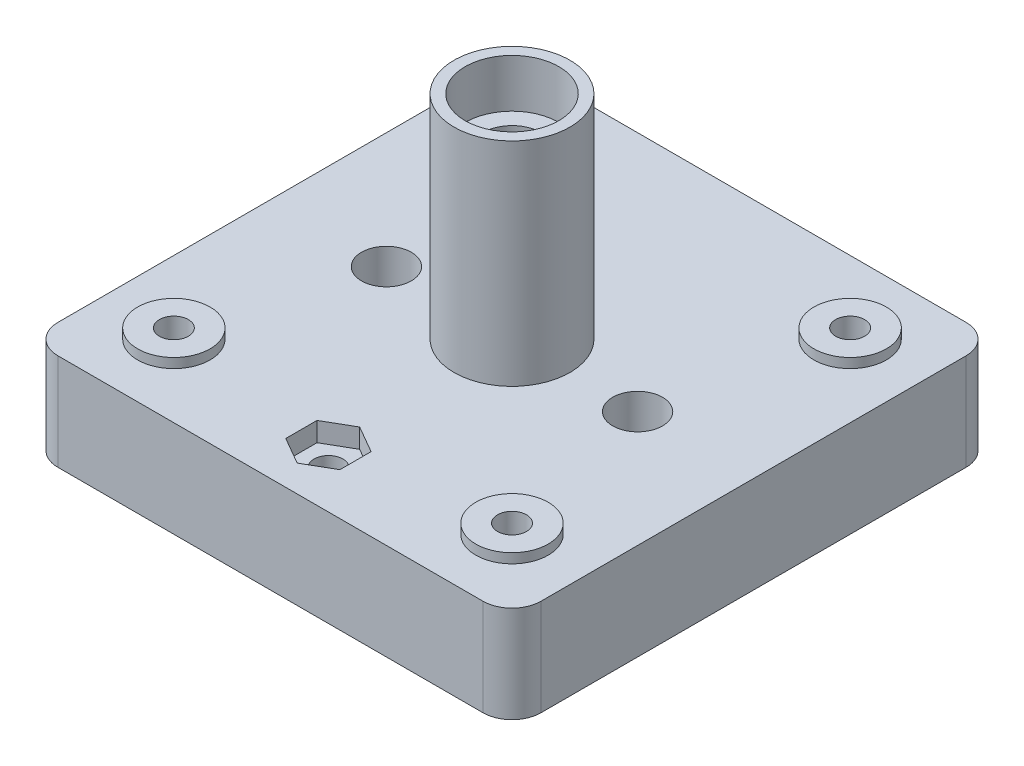
from build123d import *
from OCP.BRepFilletAPI import BRepFilletAPI_MakeChamfer

# Parameters (mm, degrees)
SKETCH1_W               = 50
SKETCH1_H               = 50
BODY_DEPTH              = 10
SKETCH2_R               = 11.5
CUT_VIEW_DEPTH          = 6
FILLETBODY_R            = 3
SKETCH3_R               = 3.75
BOLT_EXTRUDE_DEPTH      = 1
BOLT_DEPTH              = 10
BOLT_DEPTH_BACK         = 16
SKETCH4_R               = 1.5
HEX_2_DEPTH             = 2
SKETCH19_R              = 1.5
HEX_BOLT_DEPTH          = 3
SKETCH6_R               = 4
FIELD1_DEPTH            = 7
FIELD2_R                = 4
SKETCH7_R               = 2.575
PORTS1_DEPTH            = 12
PORTS2_DEPTH            = 12
PORTS2_DEPTH_BACK       = 32
SKETCH10_R              = 1.575
SKETCH11_R              = 20
SKETCH11_R_2            = 15
SEAL1_DEPTH             = 1
FLOWFIELD_START         = -1.5
FLOWFIELD_DEPTH         = 1.5
FLOWFIELD_CHANNEL_DEPTH = 1.5
SKETCH20_R              = 3
SKETCH20_R_2            = 1.575
BARB_DEPTH              = 3
BARB_CHAMFER_SIZE       = 2.5
BARB_CHAMFER_SIZE2      = 1
BODY_MOVE_COPY2_ANGLE   = 180
BOSS_EXTRUDE1_DEPTH     = 6
SKETCH22_R              = 6
RE_BODY_DEPTH           = 22
SKETCH23_R              = 4.85
THREAD_DEPTH            = 5
SKETCH24_R              = 3.025
PORT_DEPTH              = 37
SKETCH27_R              = 3
CUT_EXTRUDE3_DEPTH      = 15
SKETCH28_R              = 2.575
CUT_EXTRUDE4_DEPTH      = 5


with BuildPart() as part:
    # Sketch1 → Body (new body)
    with BuildSketch(Plane(origin=(0, 0, 0), x_dir=(1, 0, 0), z_dir=(0, 1, 0))):
        Rectangle(SKETCH1_W, SKETCH1_H)
    extrude(amount=BODY_DEPTH)

    # Sketch2 → Cut view (cut)
    with BuildSketch(Plane(origin=(0, 10, 0), x_dir=(1, 0, 0), z_dir=(0, 1, 0))):
        with Locations(Location((0, 0, 0), (0, 0, 270))):
            Circle(SKETCH2_R)
    extrude(amount=-CUT_VIEW_DEPTH, mode=Mode.SUBTRACT)

    # FilletBody
    filletbody_edges = [part.edges().sort_by_distance(p)[0] for p in [
        (-25, 5, -25),
        (25, 5, -25),
        (25, 5, 25),
        (-25, 5, 25),
    ]]
    fillet(filletbody_edges, radius=FILLETBODY_R)

    # Sketch3 → Bolt extrude (add)
    with BuildSketch(Plane(origin=(0, 10, 0), x_dir=(1, 0, 0), z_dir=(0, 1, 0))):
        with Locations(Location((-17.5, 17.5, 0), (0, 0, 270))):
            Circle(SKETCH3_R)
        with Locations(Location((17.5, 17.5, 0), (0, 0, 90))):
            Circle(SKETCH3_R)
        with Locations(Location((17.5, -17.5, 0), (0, 0, 270))):
            Circle(SKETCH3_R)
        with Locations(Location((-17.5, -17.5, 0), (0, 0, 90))):
            Circle(SKETCH3_R)
    extrude(amount=BOLT_EXTRUDE_DEPTH)

    # Sketch4 → Bolt (cut, two sides: drawn at the far end of the back side and taken through both)
    with BuildSketch(Plane(origin=(0, 11, 0), x_dir=(1, 0, 0), z_dir=(0, 1, 0)).offset(-BOLT_DEPTH_BACK)):
        with Locations(Location((-17.5, 17.5, 0), (0, 0, 270))):
            Circle(SKETCH4_R)
        with Locations(Location((17.5, 17.5, 0), (0, 0, 90))):
            Circle(SKETCH4_R)
        with Locations(Location((17.5, -17.5, 0), (0, 0, 270))):
            Circle(SKETCH4_R)
        with Locations(Location((-17.5, -17.5, 0), (0, 0, 90))):
            Circle(SKETCH4_R)
    extrude(amount=BOLT_DEPTH + BOLT_DEPTH_BACK, mode=Mode.SUBTRACT)

    # Sketch5 → Hex 2 (cut)
    with BuildSketch(Plane(origin=(0, 10, 0), x_dir=(1, 0, 0), z_dir=(0, 1, 0))):
        Polygon((0, 22.233161507), (-2.8, 20.616580754), (-2.8, 17.383419246), (0, 15.766838493), (2.8, 17.383419246), (2.8, 20.616580754), align=None)
    extrude(amount=-HEX_2_DEPTH, mode=Mode.SUBTRACT)

    # Sketch19 → Hex_bolt (cut)
    with BuildSketch(Plane(origin=(0, 8, 0), x_dir=(1, 0, 0), z_dir=(0, 1, 0))):
        with Locations(Location((0, 19, 0), (0, 0, 270))):
            Circle(SKETCH19_R)
    extrude(amount=-HEX_BOLT_DEPTH, mode=Mode.SUBTRACT)

    # Sketch6 → Field1 (add)
    with BuildSketch(Plane(origin=(0, 10, 0), x_dir=(1, 0, 0), z_dir=(0, 1, 0))):
        with Locations((-13, 0)):
            Circle(SKETCH6_R)
        with Locations((13, 0)):
            Circle(SKETCH6_R)
    extrude(amount=-FIELD1_DEPTH)

    # Field2
    field2_edges = [part.edges().sort_by_distance(p)[0] for p in [
        (-10.971153846, 7, 3.447286365),
        (-10.971153846, 7, -3.447286365),
        (10.971153846, 7, -3.447286365),
        (10.971153846, 7, 3.447286365),
    ]]
    fillet(field2_edges, radius=FIELD2_R)

    # Sketch7 → Ports1 (add)
    with BuildSketch(Plane(origin=(0, 10, 0), x_dir=(1, 0, 0), z_dir=(0, 1, 0))):
        with Locations(Location((-13, 0, 0), (0, 0, 270))):
            Circle(SKETCH7_R)
        with Locations(Location((13, 0, 0), (0, 0, 90))):
            Circle(SKETCH7_R)
    extrude(amount=PORTS1_DEPTH)

    # Sketch10 → Ports2 (cut, two sides: drawn at the far end of the back side and taken through both)
    with BuildSketch(Plane(origin=(0, 22, 0), x_dir=(1, 0, 0), z_dir=(0, 1, 0)).offset(-PORTS2_DEPTH_BACK)):
        with Locations(Location((-13, 0, 0), (0, 0, 270))):
            Circle(SKETCH10_R)
        with Locations(Location((13, 0, 0), (0, 0, 90))):
            Circle(SKETCH10_R)
    extrude(amount=PORTS2_DEPTH + PORTS2_DEPTH_BACK, mode=Mode.SUBTRACT)

    # Sketch11 → Seal1 (cut)
    with BuildSketch(Plane.XZ):
        with Locations(Location((0, 0, 0), (0, 0, 270))):
            Circle(SKETCH11_R)
        with Locations(Location((0, 0, 0), (0, 0, 270))):
            Circle(SKETCH11_R_2, mode=Mode.SUBTRACT)
    extrude(amount=-SEAL1_DEPTH, mode=Mode.SUBTRACT)

    # Sketch15 → FlowField (cut)
    with BuildSketch(Plane.XZ.offset(FLOWFIELD_START)):
        with BuildLine():
            ThreePointArc((13.522961568, 3.623466631), (-1.199537572, 13.948516395), (-13.943052885, 1.261457989))
            ThreePointArc((-13.943052885, 1.261457989), (-12.926234652, 1.573271646), (-11.943052885, 1.167684801))
            ThreePointArc((-11.943052885, 1.167684801), (-0.984919414, 11.95951227), (11.591109915, 3.105828541))
            ThreePointArc((11.591109915, 3.105828541), (12.815854787, 2.39872176), (13.522961568, 3.623466631))
        make_face()
        with BuildLine():
            ThreePointArc((11, 0), (1.910129954, 10.832885283), (-10.336618829, 3.762221577))
            ThreePointArc((-10.336618829, 3.762221577), (-9.738946351, 2.480508812), (-8.457233587, 3.07818129))
            ThreePointArc((-8.457233587, 3.07818129), (1.562833599, 8.863269777), (9, 0))
            Line((9, 0), (11, 0))
        make_face()
        with BuildLine():
            ThreePointArc((7.250462296, 3.380946094), (6.766772771, 2.052020045), (5.437846722, 2.53570957))
            ThreePointArc((5.437846722, 2.53570957), (-1.298637684, 5.857776043), (-6, 0))
            Line((-6, 0), (-8, 0))
            ThreePointArc((-8, 0), (-1.731516912, 7.810368057), (7.250462296, 3.380946094))
        make_face()
        with BuildLine():
            ThreePointArc((5, 0), (1.913417162, 4.619397663), (-3.535533906, 3.535533906))
            ThreePointArc((-3.535533906, 3.535533906), (-3.535533906, 2.121320344), (-2.121320344, 2.121320344))
            ThreePointArc((-2.121320344, 2.121320344), (1.148050297, 2.771638598), (3, 0))
            Line((3, 0), (5, 0))
        make_face()
        with BuildLine():
            ThreePointArc((5, 0), (1.913417162, -4.619397663), (-3.535533906, -3.535533906))
            ThreePointArc((-3.535533906, -3.535533906), (-3.535533906, -2.121320344), (-2.121320344, -2.121320344))
            ThreePointArc((-2.121320344, -2.121320344), (1.148050297, -2.771638598), (3, 0))
            Line((3, 0), (5, 0))
        make_face()
        with BuildLine():
            ThreePointArc((-8, 0), (-1.731516912, -7.810368057), (7.250462296, -3.380946094))
            ThreePointArc((7.250462296, -3.380946094), (6.766772771, -2.052020045), (5.437846722, -2.53570957))
            ThreePointArc((5.437846722, -2.53570957), (-1.298637684, -5.857776043), (-6, 0))
            Line((-6, 0), (-8, 0))
        make_face()
        with BuildLine():
            ThreePointArc((11, 0), (1.910129954, -10.832885283), (-10.336618829, -3.762221577))
            ThreePointArc((-10.336618829, -3.762221577), (-9.738946351, -2.480508812), (-8.457233587, -3.07818129))
            ThreePointArc((-8.457233587, -3.07818129), (1.562833599, -8.863269777), (9, 0))
            Line((9, 0), (11, 0))
        make_face()
        with BuildLine():
            ThreePointArc((-11.943052885, -1.167684801), (-12.926234652, -1.573271646), (-13.943052885, -1.261457989))
            ThreePointArc((-13.943052885, -1.261457989), (-1.199537572, -13.948516395), (13.522961568, -3.623466631))
            ThreePointArc((13.522961568, -3.623466631), (12.815854787, -2.39872176), (11.591109915, -3.105828541))
            ThreePointArc((11.591109915, -3.105828541), (-0.984919414, -11.95951227), (-11.943052885, -1.167684801))
        make_face()
    extrude(amount=FLOWFIELD_DEPTH, mode=Mode.SUBTRACT)

    # Sketch16 → FlowField_Channel (cut)
    with BuildSketch(Plane.XZ):
        with BuildLine():
            Line((-13, 1), (0, 1))
            ThreePointArc((0, 1), (1, 0), (0, -1))
            Line((0, -1), (-13, -1))
            ThreePointArc((-13, -1), (-14, 0), (-13, 1))
        make_face()
        with BuildLine():
            Line((13, -1), (4.429119544, -1))
            ThreePointArc((4.429119544, -1), (3.429119544, 0), (4.429119544, 1))
            Line((4.429119544, 1), (13, 1))
            ThreePointArc((13, 1), (14, 0), (13, -1))
        make_face()
    extrude(amount=-FLOWFIELD_CHANNEL_DEPTH, mode=Mode.SUBTRACT)


with BuildPart() as body_2:
    # Mirror3: mirrored copy
    add(part.part.mirror(Plane.ZX))

    # Sketch20 → Barb (add)
    # profile 1 of 2: a face of its own
    with BuildSketch(Plane.XZ.offset(22)):
        with Locations(Location((-13, 0, 0), (0, 0, 270))):
            Circle(SKETCH20_R)
        with Locations(Location((-13, 0, 0), (0, 0, 270))):
            Circle(SKETCH20_R_2, mode=Mode.SUBTRACT)
    # profile 2 of 2: a face of its own
    with BuildSketch(Plane.XZ.offset(22)):
        with Locations(Location((13, 0, 0), (0, 0, 270))):
            Circle(SKETCH20_R)
        with Locations(Location((13, 0, 0), (0, 0, 270))):
            Circle(SKETCH20_R_2, mode=Mode.SUBTRACT)
    extrude(amount=BARB_DEPTH)

    # Barb_Chamfer: one chamfer whose edges measure the first distance from different faces: ONE call of the kernel's chamfer builder (chamfer() names one face for all edges)
    barb_chamfer_edges_1 = [body_2.edges().sort_by_distance(p)[0] for p in [
        (-13, -25, 3),
    ]]
    barb_chamfer_side_1 = [body_2.faces().sort_by_distance(p)[0] for p in [
        (-13, -23.5, 3),
    ]]
    barb_chamfer_edges_2 = [body_2.edges().sort_by_distance(p)[0] for p in [
        (13, -25, 3),
    ]]
    barb_chamfer_side_2 = [body_2.faces().sort_by_distance(p)[0] for p in [
        (13, -23.5, 3),
    ]]
    barb_chamfer = BRepFilletAPI_MakeChamfer(body_2.part.solid().wrapped)
    for e in barb_chamfer_edges_1:
        barb_chamfer.Add(BARB_CHAMFER_SIZE, BARB_CHAMFER_SIZE2, e.wrapped, barb_chamfer_side_1[0].wrapped)  # the first distance lies on this face
    for e in barb_chamfer_edges_2:
        barb_chamfer.Add(BARB_CHAMFER_SIZE, BARB_CHAMFER_SIZE2, e.wrapped, barb_chamfer_side_2[0].wrapped)  # the first distance lies on this face
    add(Compound.cast(barb_chamfer.Shape()), mode=Mode.REPLACE)


with BuildPart() as body_2_1:
    # Body-Move/Copy2: moved
    add(body_2.part.rotate(Axis((0, -12.5, 0), (1, 0, 0)), BODY_MOVE_COPY2_ANGLE))


with BuildPart() as body_2_2:
    # Body-Move/Copy3: read off the stored shape, not the designer's step
    # Body-Move/Copy3: moved
    add(body_2_1.part.moved(Location((0, 25, 0))))

    # Sketch21 → Boss-Extrude1 (add)
    with BuildSketch(Plane(origin=(0, 4, 0), x_dir=(1, 0, 0), z_dir=(0, 1, 0))):
        with BuildLine():
            ThreePointArc((9.509615385, 6.466623171), (0, 11.5), (-9.509615385, 6.466623171))
            ThreePointArc((-9.509615385, 6.466623171), (-10.201044652, 4.301187917), (-9.600961538, 2.108681469))
            ThreePointArc((-9.600961538, 2.108681469), (-9, 0), (-9.600961538, -2.108681469))
            ThreePointArc((-9.600961538, -2.108681469), (-10.201044652, -4.301187917), (-9.509615385, -6.466623171))
            ThreePointArc((-9.509615385, -6.466623171), (0, -11.5), (9.509615385, -6.466623171))
            ThreePointArc((9.509615385, -6.466623171), (10.201044652, -4.301187917), (9.600961538, -2.108681469))
            ThreePointArc((9.600961538, -2.108681469), (9, 0), (9.600961538, 2.108681469))
            ThreePointArc((9.600961538, 2.108681469), (10.201044652, 4.301187917), (9.509615385, 6.466623171))
        make_face()
    extrude(amount=BOSS_EXTRUDE1_DEPTH)

    # Sketch22 → RE Body (add)
    with BuildSketch(Plane(origin=(0, 10, 0), x_dir=(1, 0, 0), z_dir=(0, 1, 0))):
        with Locations(Location((0, 0, 0), (0, 0, 270))):
            Circle(SKETCH22_R)
    extrude(amount=RE_BODY_DEPTH)

    # Sketch23 → Thread (cut)
    with BuildSketch(Plane(origin=(0, 32, 0), x_dir=(1, 0, 0), z_dir=(0, 1, 0))):
        with Locations(Location((0, 0, 0), (0, 0, 270))):
            Circle(SKETCH23_R)
    extrude(amount=-THREAD_DEPTH, mode=Mode.SUBTRACT)

    # Sketch24 → Port (cut)
    with BuildSketch(Plane(origin=(0, 27, 0), x_dir=(1, 0, 0), z_dir=(0, 1, 0))):
        with Locations(Location((0, 0, 0), (0, 0, 270))):
            Circle(SKETCH24_R)
    extrude(amount=-PORT_DEPTH, mode=Mode.SUBTRACT)

    # Sketch27 → Cut-Extrude3 (cut)
    with BuildSketch(Plane(origin=(0, 25, 0), x_dir=(1, 0, 0), z_dir=(0, 1, 0))):
        with Locations((-13, 0)):
            Circle(SKETCH27_R)
        with Locations((13, 0)):
            Circle(SKETCH27_R)
    extrude(amount=-CUT_EXTRUDE3_DEPTH, mode=Mode.SUBTRACT)

    # Sketch28 → Cut-Extrude4 (cut)
    with BuildSketch(Plane(origin=(0, 10, 0), x_dir=(1, 0, 0), z_dir=(0, 1, 0))):
        with Locations(Location((-13, 0, 0), (0, 0, 270))):
            Circle(SKETCH28_R)
        with Locations(Location((13, 0, 0), (0, 0, 270))):
            Circle(SKETCH28_R)
    extrude(amount=-CUT_EXTRUDE4_DEPTH, mode=Mode.SUBTRACT)


solid = body_2_2.part
